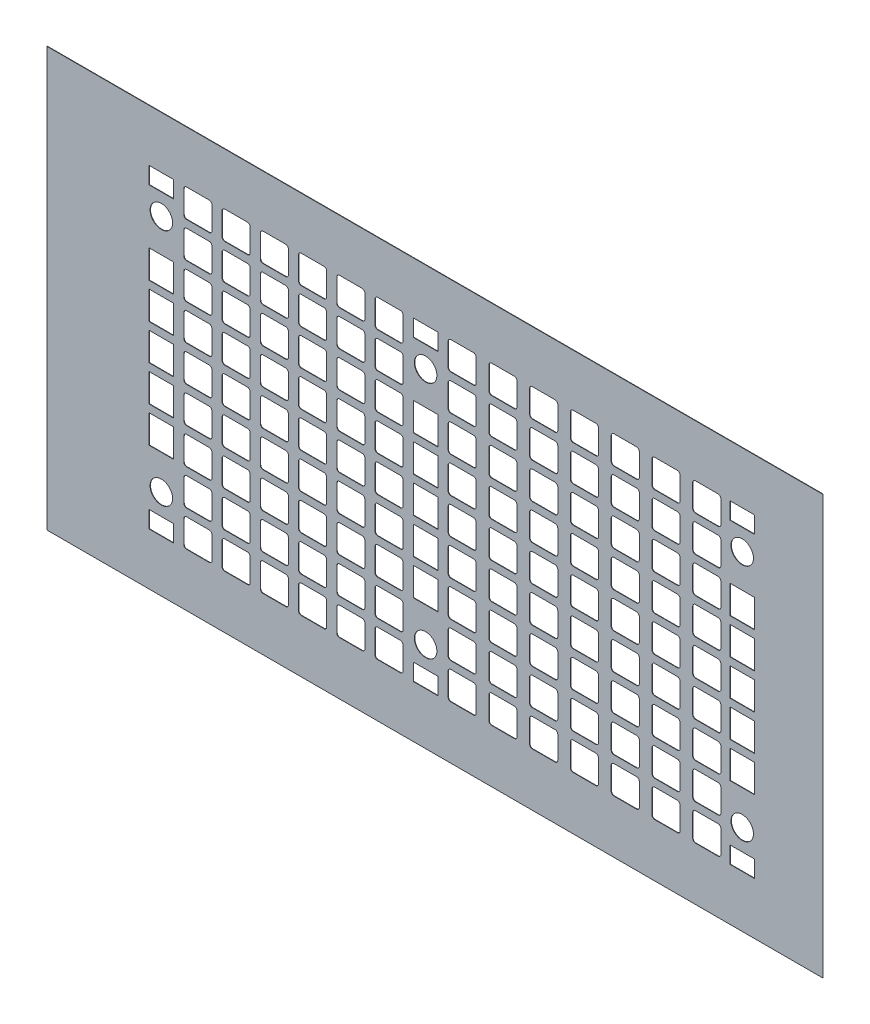
from build123d import *

# Parameters (mm, degrees)
SKETCH_1_W      = 276
SKETCH_1_H      = 149
SKETCH_1_R      = 4
SKETCH_1_W_2    = 8.8
SKETCH_1_H_2    = 10
SKETCH_1_H_3    = 6
EXTRUDE_1_DEPTH = 0.15


with BuildPart() as part:
    # Эскиз1 → Бобышка-Вытянуть1 (new body)
    with BuildSketch(Plane.XY):
        with Locations((110, 59)):
            Rectangle(SKETCH_1_W, SKETCH_1_H)
        with Locations((12.74, 16.55)):
            Circle(SKETCH_1_R, mode=Mode.SUBTRACT)
        with Locations((106.74, 16.55)):
            Circle(SKETCH_1_R, mode=Mode.SUBTRACT)
        with Locations((219.34, 16.55)):
            Circle(SKETCH_1_R, mode=Mode.SUBTRACT)
        with Locations((12.74, 101.45)):
            Circle(SKETCH_1_R, mode=Mode.SUBTRACT)
        with Locations((106.74, 101.45)):
            Circle(SKETCH_1_R, mode=Mode.SUBTRACT)
        with Locations((219.34, 101.45)):
            Circle(SKETCH_1_R, mode=Mode.SUBTRACT)
        with BuildLine():
            Line((34.34, 114), (34.34, 106))
            ThreePointArc((34.34, 106), (34.632893219, 105.292893219), (35.34, 105))
            Line((35.34, 105), (43.34, 105))
            ThreePointArc((43.34, 105), (44.047106781, 105.292893219), (44.34, 106))
            Line((44.34, 106), (44.34, 114))
            ThreePointArc((44.34, 114), (44.047106781, 114.707106781), (43.34, 115))
            Line((43.34, 115), (35.34, 115))
            ThreePointArc((35.34, 115), (34.632893219, 114.707106781), (34.34, 114))
        make_face(mode=Mode.SUBTRACT)
        with BuildLine():
            Line((21.74, 115), (29.74, 115))
            ThreePointArc((29.74, 115), (30.447106781, 114.707106781), (30.74, 114))
            Line((30.74, 114), (30.74, 106))
            ThreePointArc((30.74, 106), (30.447106781, 105.292893219), (29.74, 105))
            Line((29.74, 105), (21.74, 105))
            ThreePointArc((21.74, 105), (21.032893219, 105.292893219), (20.74, 106))
            Line((20.74, 106), (20.74, 114))
            ThreePointArc((20.74, 114), (21.032893219, 114.707106781), (21.74, 115))
        make_face(mode=Mode.SUBTRACT)
        with BuildLine():
            Line((47.94, 114), (47.94, 106))
            ThreePointArc((47.94, 106), (48.232893219, 105.292893219), (48.94, 105))
            Line((48.94, 105), (56.94, 105))
            ThreePointArc((56.94, 105), (57.647106781, 105.292893219), (57.94, 106))
            Line((57.94, 106), (57.94, 114))
            ThreePointArc((57.94, 114), (57.647106781, 114.707106781), (56.94, 115))
            Line((56.94, 115), (48.94, 115))
            ThreePointArc((48.94, 115), (48.232893219, 114.707106781), (47.94, 114))
        make_face(mode=Mode.SUBTRACT)
        with BuildLine():
            Line((61.54, 114), (61.54, 106))
            ThreePointArc((61.54, 106), (61.832893219, 105.292893219), (62.54, 105))
            Line((62.54, 105), (70.54, 105))
            ThreePointArc((70.54, 105), (71.247106781, 105.292893219), (71.54, 106))
            Line((71.54, 106), (71.54, 114))
            ThreePointArc((71.54, 114), (71.247106781, 114.707106781), (70.54, 115))
            Line((70.54, 115), (62.54, 115))
            ThreePointArc((62.54, 115), (61.832893219, 114.707106781), (61.54, 114))
        make_face(mode=Mode.SUBTRACT)
        with BuildLine():
            Line((75.14, 114), (75.14, 106))
            ThreePointArc((75.14, 106), (75.432893219, 105.292893219), (76.14, 105))
            Line((76.14, 105), (84.14, 105))
            ThreePointArc((84.14, 105), (84.847106781, 105.292893219), (85.14, 106))
            Line((85.14, 106), (85.14, 114))
            ThreePointArc((85.14, 114), (84.847106781, 114.707106781), (84.14, 115))
            Line((84.14, 115), (76.14, 115))
            ThreePointArc((76.14, 115), (75.432893219, 114.707106781), (75.14, 114))
        make_face(mode=Mode.SUBTRACT)
        with BuildLine():
            Line((88.74, 114), (88.74, 106))
            ThreePointArc((88.74, 106), (89.032893219, 105.292893219), (89.74, 105))
            Line((89.74, 105), (97.74, 105))
            ThreePointArc((97.74, 105), (98.447106781, 105.292893219), (98.74, 106))
            Line((98.74, 106), (98.74, 114))
            ThreePointArc((98.74, 114), (98.447106781, 114.707106781), (97.74, 115))
            Line((97.74, 115), (89.74, 115))
            ThreePointArc((89.74, 115), (89.032893219, 114.707106781), (88.74, 114))
        make_face(mode=Mode.SUBTRACT)
        with BuildLine():
            Line((34.34, 101.3), (34.34, 93.3))
            ThreePointArc((34.34, 93.3), (34.632893219, 92.592893219), (35.34, 92.3))
            Line((35.34, 92.3), (43.34, 92.3))
            ThreePointArc((43.34, 92.3), (44.047106781, 92.592893219), (44.34, 93.3))
            Line((44.34, 93.3), (44.34, 101.3))
            ThreePointArc((44.34, 101.3), (44.047106781, 102.007106781), (43.34, 102.3))
            Line((43.34, 102.3), (35.34, 102.3))
            ThreePointArc((35.34, 102.3), (34.632893219, 102.007106781), (34.34, 101.3))
        make_face(mode=Mode.SUBTRACT)
        with BuildLine():
            Line((47.94, 101.3), (47.94, 93.3))
            ThreePointArc((47.94, 93.3), (48.232893219, 92.592893219), (48.94, 92.3))
            Line((48.94, 92.3), (56.94, 92.3))
            ThreePointArc((56.94, 92.3), (57.647106781, 92.592893219), (57.94, 93.3))
            Line((57.94, 93.3), (57.94, 101.3))
            ThreePointArc((57.94, 101.3), (57.647106781, 102.007106781), (56.94, 102.3))
            Line((56.94, 102.3), (48.94, 102.3))
            ThreePointArc((48.94, 102.3), (48.232893219, 102.007106781), (47.94, 101.3))
        make_face(mode=Mode.SUBTRACT)
        with BuildLine():
            Line((61.54, 101.3), (61.54, 93.3))
            ThreePointArc((61.54, 93.3), (61.832893219, 92.592893219), (62.54, 92.3))
            Line((62.54, 92.3), (70.54, 92.3))
            ThreePointArc((70.54, 92.3), (71.247106781, 92.592893219), (71.54, 93.3))
            Line((71.54, 93.3), (71.54, 101.3))
            ThreePointArc((71.54, 101.3), (71.247106781, 102.007106781), (70.54, 102.3))
            Line((70.54, 102.3), (62.54, 102.3))
            ThreePointArc((62.54, 102.3), (61.832893219, 102.007106781), (61.54, 101.3))
        make_face(mode=Mode.SUBTRACT)
        with BuildLine():
            Line((75.14, 101.3), (75.14, 93.3))
            ThreePointArc((75.14, 93.3), (75.432893219, 92.592893219), (76.14, 92.3))
            Line((76.14, 92.3), (84.14, 92.3))
            ThreePointArc((84.14, 92.3), (84.847106781, 92.592893219), (85.14, 93.3))
            Line((85.14, 93.3), (85.14, 101.3))
            ThreePointArc((85.14, 101.3), (84.847106781, 102.007106781), (84.14, 102.3))
            Line((84.14, 102.3), (76.14, 102.3))
            ThreePointArc((76.14, 102.3), (75.432893219, 102.007106781), (75.14, 101.3))
        make_face(mode=Mode.SUBTRACT)
        with BuildLine():
            Line((88.74, 101.3), (88.74, 93.3))
            ThreePointArc((88.74, 93.3), (89.032893219, 92.592893219), (89.74, 92.3))
            Line((89.74, 92.3), (97.74, 92.3))
            ThreePointArc((97.74, 92.3), (98.447106781, 92.592893219), (98.74, 93.3))
            Line((98.74, 93.3), (98.74, 101.3))
            ThreePointArc((98.74, 101.3), (98.447106781, 102.007106781), (97.74, 102.3))
            Line((97.74, 102.3), (89.74, 102.3))
            ThreePointArc((89.74, 102.3), (89.032893219, 102.007106781), (88.74, 101.3))
        make_face(mode=Mode.SUBTRACT)
        with BuildLine():
            Line((34.34, 88.6), (34.34, 80.6))
            ThreePointArc((34.34, 80.6), (34.632893219, 79.892893219), (35.34, 79.6))
            Line((35.34, 79.6), (43.34, 79.6))
            ThreePointArc((43.34, 79.6), (44.047106781, 79.892893219), (44.34, 80.6))
            Line((44.34, 80.6), (44.34, 88.6))
            ThreePointArc((44.34, 88.6), (44.047106781, 89.307106781), (43.34, 89.6))
            Line((43.34, 89.6), (35.34, 89.6))
            ThreePointArc((35.34, 89.6), (34.632893219, 89.307106781), (34.34, 88.6))
        make_face(mode=Mode.SUBTRACT)
        with BuildLine():
            Line((47.94, 88.6), (47.94, 80.6))
            ThreePointArc((47.94, 80.6), (48.232893219, 79.892893219), (48.94, 79.6))
            Line((48.94, 79.6), (56.94, 79.6))
            ThreePointArc((56.94, 79.6), (57.647106781, 79.892893219), (57.94, 80.6))
            Line((57.94, 80.6), (57.94, 88.6))
            ThreePointArc((57.94, 88.6), (57.647106781, 89.307106781), (56.94, 89.6))
            Line((56.94, 89.6), (48.94, 89.6))
            ThreePointArc((48.94, 89.6), (48.232893219, 89.307106781), (47.94, 88.6))
        make_face(mode=Mode.SUBTRACT)
        with BuildLine():
            Line((61.54, 88.6), (61.54, 80.6))
            ThreePointArc((61.54, 80.6), (61.832893219, 79.892893219), (62.54, 79.6))
            Line((62.54, 79.6), (70.54, 79.6))
            ThreePointArc((70.54, 79.6), (71.247106781, 79.892893219), (71.54, 80.6))
            Line((71.54, 80.6), (71.54, 88.6))
            ThreePointArc((71.54, 88.6), (71.247106781, 89.307106781), (70.54, 89.6))
            Line((70.54, 89.6), (62.54, 89.6))
            ThreePointArc((62.54, 89.6), (61.832893219, 89.307106781), (61.54, 88.6))
        make_face(mode=Mode.SUBTRACT)
        with BuildLine():
            Line((75.14, 88.6), (75.14, 80.6))
            ThreePointArc((75.14, 80.6), (75.432893219, 79.892893219), (76.14, 79.6))
            Line((76.14, 79.6), (84.14, 79.6))
            ThreePointArc((84.14, 79.6), (84.847106781, 79.892893219), (85.14, 80.6))
            Line((85.14, 80.6), (85.14, 88.6))
            ThreePointArc((85.14, 88.6), (84.847106781, 89.307106781), (84.14, 89.6))
            Line((84.14, 89.6), (76.14, 89.6))
            ThreePointArc((76.14, 89.6), (75.432893219, 89.307106781), (75.14, 88.6))
        make_face(mode=Mode.SUBTRACT)
        with BuildLine():
            Line((88.74, 88.6), (88.74, 80.6))
            ThreePointArc((88.74, 80.6), (89.032893219, 79.892893219), (89.74, 79.6))
            Line((89.74, 79.6), (97.74, 79.6))
            ThreePointArc((97.74, 79.6), (98.447106781, 79.892893219), (98.74, 80.6))
            Line((98.74, 80.6), (98.74, 88.6))
            ThreePointArc((98.74, 88.6), (98.447106781, 89.307106781), (97.74, 89.6))
            Line((97.74, 89.6), (89.74, 89.6))
            ThreePointArc((89.74, 89.6), (89.032893219, 89.307106781), (88.74, 88.6))
        make_face(mode=Mode.SUBTRACT)
        with BuildLine():
            Line((34.34, 75.9), (34.34, 67.9))
            ThreePointArc((34.34, 67.9), (34.632893219, 67.192893219), (35.34, 66.9))
            Line((35.34, 66.9), (43.34, 66.9))
            ThreePointArc((43.34, 66.9), (44.047106781, 67.192893219), (44.34, 67.9))
            Line((44.34, 67.9), (44.34, 75.9))
            ThreePointArc((44.34, 75.9), (44.047106781, 76.607106781), (43.34, 76.9))
            Line((43.34, 76.9), (35.34, 76.9))
            ThreePointArc((35.34, 76.9), (34.632893219, 76.607106781), (34.34, 75.9))
        make_face(mode=Mode.SUBTRACT)
        with BuildLine():
            Line((47.94, 75.9), (47.94, 67.9))
            ThreePointArc((47.94, 67.9), (48.232893219, 67.192893219), (48.94, 66.9))
            Line((48.94, 66.9), (56.94, 66.9))
            ThreePointArc((56.94, 66.9), (57.647106781, 67.192893219), (57.94, 67.9))
            Line((57.94, 67.9), (57.94, 75.9))
            ThreePointArc((57.94, 75.9), (57.647106781, 76.607106781), (56.94, 76.9))
            Line((56.94, 76.9), (48.94, 76.9))
            ThreePointArc((48.94, 76.9), (48.232893219, 76.607106781), (47.94, 75.9))
        make_face(mode=Mode.SUBTRACT)
        with BuildLine():
            Line((61.54, 75.9), (61.54, 67.9))
            ThreePointArc((61.54, 67.9), (61.832893219, 67.192893219), (62.54, 66.9))
            Line((62.54, 66.9), (70.54, 66.9))
            ThreePointArc((70.54, 66.9), (71.247106781, 67.192893219), (71.54, 67.9))
            Line((71.54, 67.9), (71.54, 75.9))
            ThreePointArc((71.54, 75.9), (71.247106781, 76.607106781), (70.54, 76.9))
            Line((70.54, 76.9), (62.54, 76.9))
            ThreePointArc((62.54, 76.9), (61.832893219, 76.607106781), (61.54, 75.9))
        make_face(mode=Mode.SUBTRACT)
        with BuildLine():
            Line((75.14, 75.9), (75.14, 67.9))
            ThreePointArc((75.14, 67.9), (75.432893219, 67.192893219), (76.14, 66.9))
            Line((76.14, 66.9), (84.14, 66.9))
            ThreePointArc((84.14, 66.9), (84.847106781, 67.192893219), (85.14, 67.9))
            Line((85.14, 67.9), (85.14, 75.9))
            ThreePointArc((85.14, 75.9), (84.847106781, 76.607106781), (84.14, 76.9))
            Line((84.14, 76.9), (76.14, 76.9))
            ThreePointArc((76.14, 76.9), (75.432893219, 76.607106781), (75.14, 75.9))
        make_face(mode=Mode.SUBTRACT)
        with BuildLine():
            Line((88.74, 75.9), (88.74, 67.9))
            ThreePointArc((88.74, 67.9), (89.032893219, 67.192893219), (89.74, 66.9))
            Line((89.74, 66.9), (97.74, 66.9))
            ThreePointArc((97.74, 66.9), (98.447106781, 67.192893219), (98.74, 67.9))
            Line((98.74, 67.9), (98.74, 75.9))
            ThreePointArc((98.74, 75.9), (98.447106781, 76.607106781), (97.74, 76.9))
            Line((97.74, 76.9), (89.74, 76.9))
            ThreePointArc((89.74, 76.9), (89.032893219, 76.607106781), (88.74, 75.9))
        make_face(mode=Mode.SUBTRACT)
        with BuildLine():
            Line((34.34, 63.2), (34.34, 55.2))
            ThreePointArc((34.34, 55.2), (34.632893219, 54.492893219), (35.34, 54.2))
            Line((35.34, 54.2), (43.34, 54.2))
            ThreePointArc((43.34, 54.2), (44.047106781, 54.492893219), (44.34, 55.2))
            Line((44.34, 55.2), (44.34, 63.2))
            ThreePointArc((44.34, 63.2), (44.047106781, 63.907106781), (43.34, 64.2))
            Line((43.34, 64.2), (35.34, 64.2))
            ThreePointArc((35.34, 64.2), (34.632893219, 63.907106781), (34.34, 63.2))
        make_face(mode=Mode.SUBTRACT)
        with BuildLine():
            Line((47.94, 63.2), (47.94, 55.2))
            ThreePointArc((47.94, 55.2), (48.232893219, 54.492893219), (48.94, 54.2))
            Line((48.94, 54.2), (56.94, 54.2))
            ThreePointArc((56.94, 54.2), (57.647106781, 54.492893219), (57.94, 55.2))
            Line((57.94, 55.2), (57.94, 63.2))
            ThreePointArc((57.94, 63.2), (57.647106781, 63.907106781), (56.94, 64.2))
            Line((56.94, 64.2), (48.94, 64.2))
            ThreePointArc((48.94, 64.2), (48.232893219, 63.907106781), (47.94, 63.2))
        make_face(mode=Mode.SUBTRACT)
        with BuildLine():
            Line((61.54, 63.2), (61.54, 55.2))
            ThreePointArc((61.54, 55.2), (61.832893219, 54.492893219), (62.54, 54.2))
            Line((62.54, 54.2), (70.54, 54.2))
            ThreePointArc((70.54, 54.2), (71.247106781, 54.492893219), (71.54, 55.2))
            Line((71.54, 55.2), (71.54, 63.2))
            ThreePointArc((71.54, 63.2), (71.247106781, 63.907106781), (70.54, 64.2))
            Line((70.54, 64.2), (62.54, 64.2))
            ThreePointArc((62.54, 64.2), (61.832893219, 63.907106781), (61.54, 63.2))
        make_face(mode=Mode.SUBTRACT)
        with BuildLine():
            Line((75.14, 63.2), (75.14, 55.2))
            ThreePointArc((75.14, 55.2), (75.432893219, 54.492893219), (76.14, 54.2))
            Line((76.14, 54.2), (84.14, 54.2))
            ThreePointArc((84.14, 54.2), (84.847106781, 54.492893219), (85.14, 55.2))
            Line((85.14, 55.2), (85.14, 63.2))
            ThreePointArc((85.14, 63.2), (84.847106781, 63.907106781), (84.14, 64.2))
            Line((84.14, 64.2), (76.14, 64.2))
            ThreePointArc((76.14, 64.2), (75.432893219, 63.907106781), (75.14, 63.2))
        make_face(mode=Mode.SUBTRACT)
        with BuildLine():
            Line((88.74, 63.2), (88.74, 55.2))
            ThreePointArc((88.74, 55.2), (89.032893219, 54.492893219), (89.74, 54.2))
            Line((89.74, 54.2), (97.74, 54.2))
            ThreePointArc((97.74, 54.2), (98.447106781, 54.492893219), (98.74, 55.2))
            Line((98.74, 55.2), (98.74, 63.2))
            ThreePointArc((98.74, 63.2), (98.447106781, 63.907106781), (97.74, 64.2))
            Line((97.74, 64.2), (89.74, 64.2))
            ThreePointArc((89.74, 64.2), (89.032893219, 63.907106781), (88.74, 63.2))
        make_face(mode=Mode.SUBTRACT)
        with BuildLine():
            Line((34.34, 50.5), (34.34, 42.5))
            ThreePointArc((34.34, 42.5), (34.632893219, 41.792893219), (35.34, 41.5))
            Line((35.34, 41.5), (43.34, 41.5))
            ThreePointArc((43.34, 41.5), (44.047106781, 41.792893219), (44.34, 42.5))
            Line((44.34, 42.5), (44.34, 50.5))
            ThreePointArc((44.34, 50.5), (44.047106781, 51.207106781), (43.34, 51.5))
            Line((43.34, 51.5), (35.34, 51.5))
            ThreePointArc((35.34, 51.5), (34.632893219, 51.207106781), (34.34, 50.5))
        make_face(mode=Mode.SUBTRACT)
        with BuildLine():
            Line((47.94, 50.5), (47.94, 42.5))
            ThreePointArc((47.94, 42.5), (48.232893219, 41.792893219), (48.94, 41.5))
            Line((48.94, 41.5), (56.94, 41.5))
            ThreePointArc((56.94, 41.5), (57.647106781, 41.792893219), (57.94, 42.5))
            Line((57.94, 42.5), (57.94, 50.5))
            ThreePointArc((57.94, 50.5), (57.647106781, 51.207106781), (56.94, 51.5))
            Line((56.94, 51.5), (48.94, 51.5))
            ThreePointArc((48.94, 51.5), (48.232893219, 51.207106781), (47.94, 50.5))
        make_face(mode=Mode.SUBTRACT)
        with BuildLine():
            Line((61.54, 50.5), (61.54, 42.5))
            ThreePointArc((61.54, 42.5), (61.832893219, 41.792893219), (62.54, 41.5))
            Line((62.54, 41.5), (70.54, 41.5))
            ThreePointArc((70.54, 41.5), (71.247106781, 41.792893219), (71.54, 42.5))
            Line((71.54, 42.5), (71.54, 50.5))
            ThreePointArc((71.54, 50.5), (71.247106781, 51.207106781), (70.54, 51.5))
            Line((70.54, 51.5), (62.54, 51.5))
            ThreePointArc((62.54, 51.5), (61.832893219, 51.207106781), (61.54, 50.5))
        make_face(mode=Mode.SUBTRACT)
        with BuildLine():
            Line((75.14, 50.5), (75.14, 42.5))
            ThreePointArc((75.14, 42.5), (75.432893219, 41.792893219), (76.14, 41.5))
            Line((76.14, 41.5), (84.14, 41.5))
            ThreePointArc((84.14, 41.5), (84.847106781, 41.792893219), (85.14, 42.5))
            Line((85.14, 42.5), (85.14, 50.5))
            ThreePointArc((85.14, 50.5), (84.847106781, 51.207106781), (84.14, 51.5))
            Line((84.14, 51.5), (76.14, 51.5))
            ThreePointArc((76.14, 51.5), (75.432893219, 51.207106781), (75.14, 50.5))
        make_face(mode=Mode.SUBTRACT)
        with BuildLine():
            Line((88.74, 50.5), (88.74, 42.5))
            ThreePointArc((88.74, 42.5), (89.032893219, 41.792893219), (89.74, 41.5))
            Line((89.74, 41.5), (97.74, 41.5))
            ThreePointArc((97.74, 41.5), (98.447106781, 41.792893219), (98.74, 42.5))
            Line((98.74, 42.5), (98.74, 50.5))
            ThreePointArc((98.74, 50.5), (98.447106781, 51.207106781), (97.74, 51.5))
            Line((97.74, 51.5), (89.74, 51.5))
            ThreePointArc((89.74, 51.5), (89.032893219, 51.207106781), (88.74, 50.5))
        make_face(mode=Mode.SUBTRACT)
        with BuildLine():
            Line((34.34, 37.8), (34.34, 29.8))
            ThreePointArc((34.34, 29.8), (34.632893219, 29.092893219), (35.34, 28.8))
            Line((35.34, 28.8), (43.34, 28.8))
            ThreePointArc((43.34, 28.8), (44.047106781, 29.092893219), (44.34, 29.8))
            Line((44.34, 29.8), (44.34, 37.8))
            ThreePointArc((44.34, 37.8), (44.047106781, 38.507106781), (43.34, 38.8))
            Line((43.34, 38.8), (35.34, 38.8))
            ThreePointArc((35.34, 38.8), (34.632893219, 38.507106781), (34.34, 37.8))
        make_face(mode=Mode.SUBTRACT)
        with BuildLine():
            Line((47.94, 37.8), (47.94, 29.8))
            ThreePointArc((47.94, 29.8), (48.232893219, 29.092893219), (48.94, 28.8))
            Line((48.94, 28.8), (56.94, 28.8))
            ThreePointArc((56.94, 28.8), (57.647106781, 29.092893219), (57.94, 29.8))
            Line((57.94, 29.8), (57.94, 37.8))
            ThreePointArc((57.94, 37.8), (57.647106781, 38.507106781), (56.94, 38.8))
            Line((56.94, 38.8), (48.94, 38.8))
            ThreePointArc((48.94, 38.8), (48.232893219, 38.507106781), (47.94, 37.8))
        make_face(mode=Mode.SUBTRACT)
        with BuildLine():
            Line((61.54, 37.8), (61.54, 29.8))
            ThreePointArc((61.54, 29.8), (61.832893219, 29.092893219), (62.54, 28.8))
            Line((62.54, 28.8), (70.54, 28.8))
            ThreePointArc((70.54, 28.8), (71.247106781, 29.092893219), (71.54, 29.8))
            Line((71.54, 29.8), (71.54, 37.8))
            ThreePointArc((71.54, 37.8), (71.247106781, 38.507106781), (70.54, 38.8))
            Line((70.54, 38.8), (62.54, 38.8))
            ThreePointArc((62.54, 38.8), (61.832893219, 38.507106781), (61.54, 37.8))
        make_face(mode=Mode.SUBTRACT)
        with BuildLine():
            Line((75.14, 37.8), (75.14, 29.8))
            ThreePointArc((75.14, 29.8), (75.432893219, 29.092893219), (76.14, 28.8))
            Line((76.14, 28.8), (84.14, 28.8))
            ThreePointArc((84.14, 28.8), (84.847106781, 29.092893219), (85.14, 29.8))
            Line((85.14, 29.8), (85.14, 37.8))
            ThreePointArc((85.14, 37.8), (84.847106781, 38.507106781), (84.14, 38.8))
            Line((84.14, 38.8), (76.14, 38.8))
            ThreePointArc((76.14, 38.8), (75.432893219, 38.507106781), (75.14, 37.8))
        make_face(mode=Mode.SUBTRACT)
        with BuildLine():
            Line((88.74, 37.8), (88.74, 29.8))
            ThreePointArc((88.74, 29.8), (89.032893219, 29.092893219), (89.74, 28.8))
            Line((89.74, 28.8), (97.74, 28.8))
            ThreePointArc((97.74, 28.8), (98.447106781, 29.092893219), (98.74, 29.8))
            Line((98.74, 29.8), (98.74, 37.8))
            ThreePointArc((98.74, 37.8), (98.447106781, 38.507106781), (97.74, 38.8))
            Line((97.74, 38.8), (89.74, 38.8))
            ThreePointArc((89.74, 38.8), (89.032893219, 38.507106781), (88.74, 37.8))
        make_face(mode=Mode.SUBTRACT)
        with BuildLine():
            Line((34.34, 25.1), (34.34, 17.1))
            ThreePointArc((34.34, 17.1), (34.632893219, 16.392893219), (35.34, 16.1))
            Line((35.34, 16.1), (43.34, 16.1))
            ThreePointArc((43.34, 16.1), (44.047106781, 16.392893219), (44.34, 17.1))
            Line((44.34, 17.1), (44.34, 25.1))
            ThreePointArc((44.34, 25.1), (44.047106781, 25.807106781), (43.34, 26.1))
            Line((43.34, 26.1), (35.34, 26.1))
            ThreePointArc((35.34, 26.1), (34.632893219, 25.807106781), (34.34, 25.1))
        make_face(mode=Mode.SUBTRACT)
        with BuildLine():
            Line((47.94, 25.1), (47.94, 17.1))
            ThreePointArc((47.94, 17.1), (48.232893219, 16.392893219), (48.94, 16.1))
            Line((48.94, 16.1), (56.94, 16.1))
            ThreePointArc((56.94, 16.1), (57.647106781, 16.392893219), (57.94, 17.1))
            Line((57.94, 17.1), (57.94, 25.1))
            ThreePointArc((57.94, 25.1), (57.647106781, 25.807106781), (56.94, 26.1))
            Line((56.94, 26.1), (48.94, 26.1))
            ThreePointArc((48.94, 26.1), (48.232893219, 25.807106781), (47.94, 25.1))
        make_face(mode=Mode.SUBTRACT)
        with BuildLine():
            Line((61.54, 25.1), (61.54, 17.1))
            ThreePointArc((61.54, 17.1), (61.832893219, 16.392893219), (62.54, 16.1))
            Line((62.54, 16.1), (70.54, 16.1))
            ThreePointArc((70.54, 16.1), (71.247106781, 16.392893219), (71.54, 17.1))
            Line((71.54, 17.1), (71.54, 25.1))
            ThreePointArc((71.54, 25.1), (71.247106781, 25.807106781), (70.54, 26.1))
            Line((70.54, 26.1), (62.54, 26.1))
            ThreePointArc((62.54, 26.1), (61.832893219, 25.807106781), (61.54, 25.1))
        make_face(mode=Mode.SUBTRACT)
        with BuildLine():
            Line((75.14, 25.1), (75.14, 17.1))
            ThreePointArc((75.14, 17.1), (75.432893219, 16.392893219), (76.14, 16.1))
            Line((76.14, 16.1), (84.14, 16.1))
            ThreePointArc((84.14, 16.1), (84.847106781, 16.392893219), (85.14, 17.1))
            Line((85.14, 17.1), (85.14, 25.1))
            ThreePointArc((85.14, 25.1), (84.847106781, 25.807106781), (84.14, 26.1))
            Line((84.14, 26.1), (76.14, 26.1))
            ThreePointArc((76.14, 26.1), (75.432893219, 25.807106781), (75.14, 25.1))
        make_face(mode=Mode.SUBTRACT)
        with BuildLine():
            Line((88.74, 25.1), (88.74, 17.1))
            ThreePointArc((88.74, 17.1), (89.032893219, 16.392893219), (89.74, 16.1))
            Line((89.74, 16.1), (97.74, 16.1))
            ThreePointArc((97.74, 16.1), (98.447106781, 16.392893219), (98.74, 17.1))
            Line((98.74, 17.1), (98.74, 25.1))
            ThreePointArc((98.74, 25.1), (98.447106781, 25.807106781), (97.74, 26.1))
            Line((97.74, 26.1), (89.74, 26.1))
            ThreePointArc((89.74, 26.1), (89.032893219, 25.807106781), (88.74, 25.1))
        make_face(mode=Mode.SUBTRACT)
        with BuildLine():
            Line((34.34, 12.4), (34.34, 4.4))
            ThreePointArc((34.34, 4.4), (34.632893219, 3.692893219), (35.34, 3.4))
            Line((35.34, 3.4), (43.34, 3.4))
            ThreePointArc((43.34, 3.4), (44.047106781, 3.692893219), (44.34, 4.4))
            Line((44.34, 4.4), (44.34, 12.4))
            ThreePointArc((44.34, 12.4), (44.047106781, 13.107106781), (43.34, 13.4))
            Line((43.34, 13.4), (35.34, 13.4))
            ThreePointArc((35.34, 13.4), (34.632893219, 13.107106781), (34.34, 12.4))
        make_face(mode=Mode.SUBTRACT)
        with BuildLine():
            Line((47.94, 12.4), (47.94, 4.4))
            ThreePointArc((47.94, 4.4), (48.232893219, 3.692893219), (48.94, 3.4))
            Line((48.94, 3.4), (56.94, 3.4))
            ThreePointArc((56.94, 3.4), (57.647106781, 3.692893219), (57.94, 4.4))
            Line((57.94, 4.4), (57.94, 12.4))
            ThreePointArc((57.94, 12.4), (57.647106781, 13.107106781), (56.94, 13.4))
            Line((56.94, 13.4), (48.94, 13.4))
            ThreePointArc((48.94, 13.4), (48.232893219, 13.107106781), (47.94, 12.4))
        make_face(mode=Mode.SUBTRACT)
        with BuildLine():
            Line((61.54, 12.4), (61.54, 4.4))
            ThreePointArc((61.54, 4.4), (61.832893219, 3.692893219), (62.54, 3.4))
            Line((62.54, 3.4), (70.54, 3.4))
            ThreePointArc((70.54, 3.4), (71.247106781, 3.692893219), (71.54, 4.4))
            Line((71.54, 4.4), (71.54, 12.4))
            ThreePointArc((71.54, 12.4), (71.247106781, 13.107106781), (70.54, 13.4))
            Line((70.54, 13.4), (62.54, 13.4))
            ThreePointArc((62.54, 13.4), (61.832893219, 13.107106781), (61.54, 12.4))
        make_face(mode=Mode.SUBTRACT)
        with BuildLine():
            Line((75.14, 12.4), (75.14, 4.4))
            ThreePointArc((75.14, 4.4), (75.432893219, 3.692893219), (76.14, 3.4))
            Line((76.14, 3.4), (84.14, 3.4))
            ThreePointArc((84.14, 3.4), (84.847106781, 3.692893219), (85.14, 4.4))
            Line((85.14, 4.4), (85.14, 12.4))
            ThreePointArc((85.14, 12.4), (84.847106781, 13.107106781), (84.14, 13.4))
            Line((84.14, 13.4), (76.14, 13.4))
            ThreePointArc((76.14, 13.4), (75.432893219, 13.107106781), (75.14, 12.4))
        make_face(mode=Mode.SUBTRACT)
        with BuildLine():
            Line((88.74, 12.4), (88.74, 4.4))
            ThreePointArc((88.74, 4.4), (89.032893219, 3.692893219), (89.74, 3.4))
            Line((89.74, 3.4), (97.74, 3.4))
            ThreePointArc((97.74, 3.4), (98.447106781, 3.692893219), (98.74, 4.4))
            Line((98.74, 4.4), (98.74, 12.4))
            ThreePointArc((98.74, 12.4), (98.447106781, 13.107106781), (97.74, 13.4))
            Line((97.74, 13.4), (89.74, 13.4))
            ThreePointArc((89.74, 13.4), (89.032893219, 13.107106781), (88.74, 12.4))
        make_face(mode=Mode.SUBTRACT)
        with BuildLine():
            Line((20.74, 101.3), (20.74, 93.3))
            ThreePointArc((20.74, 93.3), (21.032893219, 92.592893219), (21.74, 92.3))
            Line((21.74, 92.3), (29.74, 92.3))
            ThreePointArc((29.74, 92.3), (30.447106781, 92.592893219), (30.74, 93.3))
            Line((30.74, 93.3), (30.74, 101.3))
            ThreePointArc((30.74, 101.3), (30.447106781, 102.007106781), (29.74, 102.3))
            Line((29.74, 102.3), (21.74, 102.3))
            ThreePointArc((21.74, 102.3), (21.032893219, 102.007106781), (20.74, 101.3))
        make_face(mode=Mode.SUBTRACT)
        with BuildLine():
            Line((20.74, 88.6), (20.74, 80.6))
            ThreePointArc((20.74, 80.6), (21.032893219, 79.892893219), (21.74, 79.6))
            Line((21.74, 79.6), (29.74, 79.6))
            ThreePointArc((29.74, 79.6), (30.447106781, 79.892893219), (30.74, 80.6))
            Line((30.74, 80.6), (30.74, 88.6))
            ThreePointArc((30.74, 88.6), (30.447106781, 89.307106781), (29.74, 89.6))
            Line((29.74, 89.6), (21.74, 89.6))
            ThreePointArc((21.74, 89.6), (21.032893219, 89.307106781), (20.74, 88.6))
        make_face(mode=Mode.SUBTRACT)
        with BuildLine():
            Line((20.74, 75.9), (20.74, 67.9))
            ThreePointArc((20.74, 67.9), (21.032893219, 67.192893219), (21.74, 66.9))
            Line((21.74, 66.9), (29.74, 66.9))
            ThreePointArc((29.74, 66.9), (30.447106781, 67.192893219), (30.74, 67.9))
            Line((30.74, 67.9), (30.74, 75.9))
            ThreePointArc((30.74, 75.9), (30.447106781, 76.607106781), (29.74, 76.9))
            Line((29.74, 76.9), (21.74, 76.9))
            ThreePointArc((21.74, 76.9), (21.032893219, 76.607106781), (20.74, 75.9))
        make_face(mode=Mode.SUBTRACT)
        with BuildLine():
            Line((20.74, 63.2), (20.74, 55.2))
            ThreePointArc((20.74, 55.2), (21.032893219, 54.492893219), (21.74, 54.2))
            Line((21.74, 54.2), (29.74, 54.2))
            ThreePointArc((29.74, 54.2), (30.447106781, 54.492893219), (30.74, 55.2))
            Line((30.74, 55.2), (30.74, 63.2))
            ThreePointArc((30.74, 63.2), (30.447106781, 63.907106781), (29.74, 64.2))
            Line((29.74, 64.2), (21.74, 64.2))
            ThreePointArc((21.74, 64.2), (21.032893219, 63.907106781), (20.74, 63.2))
        make_face(mode=Mode.SUBTRACT)
        with BuildLine():
            Line((20.74, 50.5), (20.74, 42.5))
            ThreePointArc((20.74, 42.5), (21.032893219, 41.792893219), (21.74, 41.5))
            Line((21.74, 41.5), (29.74, 41.5))
            ThreePointArc((29.74, 41.5), (30.447106781, 41.792893219), (30.74, 42.5))
            Line((30.74, 42.5), (30.74, 50.5))
            ThreePointArc((30.74, 50.5), (30.447106781, 51.207106781), (29.74, 51.5))
            Line((29.74, 51.5), (21.74, 51.5))
            ThreePointArc((21.74, 51.5), (21.032893219, 51.207106781), (20.74, 50.5))
        make_face(mode=Mode.SUBTRACT)
        with BuildLine():
            Line((20.74, 37.8), (20.74, 29.8))
            ThreePointArc((20.74, 29.8), (21.032893219, 29.092893219), (21.74, 28.8))
            Line((21.74, 28.8), (29.74, 28.8))
            ThreePointArc((29.74, 28.8), (30.447106781, 29.092893219), (30.74, 29.8))
            Line((30.74, 29.8), (30.74, 37.8))
            ThreePointArc((30.74, 37.8), (30.447106781, 38.507106781), (29.74, 38.8))
            Line((29.74, 38.8), (21.74, 38.8))
            ThreePointArc((21.74, 38.8), (21.032893219, 38.507106781), (20.74, 37.8))
        make_face(mode=Mode.SUBTRACT)
        with BuildLine():
            Line((20.74, 25.1), (20.74, 17.1))
            ThreePointArc((20.74, 17.1), (21.032893219, 16.392893219), (21.74, 16.1))
            Line((21.74, 16.1), (29.74, 16.1))
            ThreePointArc((29.74, 16.1), (30.447106781, 16.392893219), (30.74, 17.1))
            Line((30.74, 17.1), (30.74, 25.1))
            ThreePointArc((30.74, 25.1), (30.447106781, 25.807106781), (29.74, 26.1))
            Line((29.74, 26.1), (21.74, 26.1))
            ThreePointArc((21.74, 26.1), (21.032893219, 25.807106781), (20.74, 25.1))
        make_face(mode=Mode.SUBTRACT)
        with BuildLine():
            Line((20.74, 12.4), (20.74, 4.4))
            ThreePointArc((20.74, 4.4), (21.032893219, 3.692893219), (21.74, 3.4))
            Line((21.74, 3.4), (29.74, 3.4))
            ThreePointArc((29.74, 3.4), (30.447106781, 3.692893219), (30.74, 4.4))
            Line((30.74, 4.4), (30.74, 12.4))
            ThreePointArc((30.74, 12.4), (30.447106781, 13.107106781), (29.74, 13.4))
            Line((29.74, 13.4), (21.74, 13.4))
            ThreePointArc((21.74, 13.4), (21.032893219, 13.107106781), (20.74, 12.4))
        make_face(mode=Mode.SUBTRACT)
        with BuildLine():
            Line((123.74, 115), (115.74, 115))
            ThreePointArc((115.74, 115), (115.032893219, 114.707106781), (114.74, 114))
            Line((114.74, 114), (114.74, 106))
            ThreePointArc((114.74, 106), (115.032893219, 105.292893219), (115.74, 105))
            Line((115.74, 105), (123.74, 105))
            ThreePointArc((123.74, 105), (124.447106781, 105.292893219), (124.74, 106))
            Line((124.74, 106), (124.74, 114))
            ThreePointArc((124.74, 114), (124.447106781, 114.707106781), (123.74, 115))
        make_face(mode=Mode.SUBTRACT)
        with BuildLine():
            Line((139.24, 114), (139.24, 106))
            ThreePointArc((139.24, 106), (138.947106781, 105.292893219), (138.24, 105))
            Line((138.24, 105), (130.24, 105))
            ThreePointArc((130.24, 105), (129.532893219, 105.292893219), (129.24, 106))
            Line((129.24, 106), (129.24, 114))
            ThreePointArc((129.24, 114), (129.532893219, 114.707106781), (130.24, 115))
            Line((130.24, 115), (138.24, 115))
            ThreePointArc((138.24, 115), (138.947106781, 114.707106781), (139.24, 114))
        make_face(mode=Mode.SUBTRACT)
        with BuildLine():
            Line((153.74, 114), (153.74, 106))
            ThreePointArc((153.74, 106), (153.447106781, 105.292893219), (152.74, 105))
            Line((152.74, 105), (144.74, 105))
            ThreePointArc((144.74, 105), (144.032893219, 105.292893219), (143.74, 106))
            Line((143.74, 106), (143.74, 114))
            ThreePointArc((143.74, 114), (144.032893219, 114.707106781), (144.74, 115))
            Line((144.74, 115), (152.74, 115))
            ThreePointArc((152.74, 115), (153.447106781, 114.707106781), (153.74, 114))
        make_face(mode=Mode.SUBTRACT)
        with BuildLine():
            Line((168.24, 114), (168.24, 106))
            ThreePointArc((168.24, 106), (167.947106781, 105.292893219), (167.24, 105))
            Line((167.24, 105), (159.24, 105))
            ThreePointArc((159.24, 105), (158.532893219, 105.292893219), (158.24, 106))
            Line((158.24, 106), (158.24, 114))
            ThreePointArc((158.24, 114), (158.532893219, 114.707106781), (159.24, 115))
            Line((159.24, 115), (167.24, 115))
            ThreePointArc((167.24, 115), (167.947106781, 114.707106781), (168.24, 114))
        make_face(mode=Mode.SUBTRACT)
        with BuildLine():
            Line((182.74, 114), (182.74, 106))
            ThreePointArc((182.74, 106), (182.447106781, 105.292893219), (181.74, 105))
            Line((181.74, 105), (173.74, 105))
            ThreePointArc((173.74, 105), (173.032893219, 105.292893219), (172.74, 106))
            Line((172.74, 106), (172.74, 114))
            ThreePointArc((172.74, 114), (173.032893219, 114.707106781), (173.74, 115))
            Line((173.74, 115), (181.74, 115))
            ThreePointArc((181.74, 115), (182.447106781, 114.707106781), (182.74, 114))
        make_face(mode=Mode.SUBTRACT)
        with BuildLine():
            Line((197.24, 114), (197.24, 106))
            ThreePointArc((197.24, 106), (196.947106781, 105.292893219), (196.24, 105))
            Line((196.24, 105), (188.24, 105))
            ThreePointArc((188.24, 105), (187.532893219, 105.292893219), (187.24, 106))
            Line((187.24, 106), (187.24, 114))
            ThreePointArc((187.24, 114), (187.532893219, 114.707106781), (188.24, 115))
            Line((188.24, 115), (196.24, 115))
            ThreePointArc((196.24, 115), (196.947106781, 114.707106781), (197.24, 114))
        make_face(mode=Mode.SUBTRACT)
        with BuildLine():
            Line((211.74, 114), (211.74, 106))
            ThreePointArc((211.74, 106), (211.447106781, 105.292893219), (210.74, 105))
            Line((210.74, 105), (202.74, 105))
            ThreePointArc((202.74, 105), (202.032893219, 105.292893219), (201.74, 106))
            Line((201.74, 106), (201.74, 114))
            ThreePointArc((201.74, 114), (202.032893219, 114.707106781), (202.74, 115))
            Line((202.74, 115), (210.74, 115))
            ThreePointArc((210.74, 115), (211.447106781, 114.707106781), (211.74, 114))
        make_face(mode=Mode.SUBTRACT)
        with BuildLine():
            Line((139.24, 101.3), (139.24, 93.3))
            ThreePointArc((139.24, 93.3), (138.947106781, 92.592893219), (138.24, 92.3))
            Line((138.24, 92.3), (130.24, 92.3))
            ThreePointArc((130.24, 92.3), (129.532893219, 92.592893219), (129.24, 93.3))
            Line((129.24, 93.3), (129.24, 101.3))
            ThreePointArc((129.24, 101.3), (129.532893219, 102.007106781), (130.24, 102.3))
            Line((130.24, 102.3), (138.24, 102.3))
            ThreePointArc((138.24, 102.3), (138.947106781, 102.007106781), (139.24, 101.3))
        make_face(mode=Mode.SUBTRACT)
        with BuildLine():
            Line((153.74, 101.3), (153.74, 93.3))
            ThreePointArc((153.74, 93.3), (153.447106781, 92.592893219), (152.74, 92.3))
            Line((152.74, 92.3), (144.74, 92.3))
            ThreePointArc((144.74, 92.3), (144.032893219, 92.592893219), (143.74, 93.3))
            Line((143.74, 93.3), (143.74, 101.3))
            ThreePointArc((143.74, 101.3), (144.032893219, 102.007106781), (144.74, 102.3))
            Line((144.74, 102.3), (152.74, 102.3))
            ThreePointArc((152.74, 102.3), (153.447106781, 102.007106781), (153.74, 101.3))
        make_face(mode=Mode.SUBTRACT)
        with BuildLine():
            Line((168.24, 101.3), (168.24, 93.3))
            ThreePointArc((168.24, 93.3), (167.947106781, 92.592893219), (167.24, 92.3))
            Line((167.24, 92.3), (159.24, 92.3))
            ThreePointArc((159.24, 92.3), (158.532893219, 92.592893219), (158.24, 93.3))
            Line((158.24, 93.3), (158.24, 101.3))
            ThreePointArc((158.24, 101.3), (158.532893219, 102.007106781), (159.24, 102.3))
            Line((159.24, 102.3), (167.24, 102.3))
            ThreePointArc((167.24, 102.3), (167.947106781, 102.007106781), (168.24, 101.3))
        make_face(mode=Mode.SUBTRACT)
        with BuildLine():
            Line((182.74, 101.3), (182.74, 93.3))
            ThreePointArc((182.74, 93.3), (182.447106781, 92.592893219), (181.74, 92.3))
            Line((181.74, 92.3), (173.74, 92.3))
            ThreePointArc((173.74, 92.3), (173.032893219, 92.592893219), (172.74, 93.3))
            Line((172.74, 93.3), (172.74, 101.3))
            ThreePointArc((172.74, 101.3), (173.032893219, 102.007106781), (173.74, 102.3))
            Line((173.74, 102.3), (181.74, 102.3))
            ThreePointArc((181.74, 102.3), (182.447106781, 102.007106781), (182.74, 101.3))
        make_face(mode=Mode.SUBTRACT)
        with BuildLine():
            Line((197.24, 101.3), (197.24, 93.3))
            ThreePointArc((197.24, 93.3), (196.947106781, 92.592893219), (196.24, 92.3))
            Line((196.24, 92.3), (188.24, 92.3))
            ThreePointArc((188.24, 92.3), (187.532893219, 92.592893219), (187.24, 93.3))
            Line((187.24, 93.3), (187.24, 101.3))
            ThreePointArc((187.24, 101.3), (187.532893219, 102.007106781), (188.24, 102.3))
            Line((188.24, 102.3), (196.24, 102.3))
            ThreePointArc((196.24, 102.3), (196.947106781, 102.007106781), (197.24, 101.3))
        make_face(mode=Mode.SUBTRACT)
        with BuildLine():
            Line((211.74, 101.3), (211.74, 93.3))
            ThreePointArc((211.74, 93.3), (211.447106781, 92.592893219), (210.74, 92.3))
            Line((210.74, 92.3), (202.74, 92.3))
            ThreePointArc((202.74, 92.3), (202.032893219, 92.592893219), (201.74, 93.3))
            Line((201.74, 93.3), (201.74, 101.3))
            ThreePointArc((201.74, 101.3), (202.032893219, 102.007106781), (202.74, 102.3))
            Line((202.74, 102.3), (210.74, 102.3))
            ThreePointArc((210.74, 102.3), (211.447106781, 102.007106781), (211.74, 101.3))
        make_face(mode=Mode.SUBTRACT)
        with BuildLine():
            Line((139.24, 88.6), (139.24, 80.6))
            ThreePointArc((139.24, 80.6), (138.947106781, 79.892893219), (138.24, 79.6))
            Line((138.24, 79.6), (130.24, 79.6))
            ThreePointArc((130.24, 79.6), (129.532893219, 79.892893219), (129.24, 80.6))
            Line((129.24, 80.6), (129.24, 88.6))
            ThreePointArc((129.24, 88.6), (129.532893219, 89.307106781), (130.24, 89.6))
            Line((130.24, 89.6), (138.24, 89.6))
            ThreePointArc((138.24, 89.6), (138.947106781, 89.307106781), (139.24, 88.6))
        make_face(mode=Mode.SUBTRACT)
        with BuildLine():
            Line((153.74, 88.6), (153.74, 80.6))
            ThreePointArc((153.74, 80.6), (153.447106781, 79.892893219), (152.74, 79.6))
            Line((152.74, 79.6), (144.74, 79.6))
            ThreePointArc((144.74, 79.6), (144.032893219, 79.892893219), (143.74, 80.6))
            Line((143.74, 80.6), (143.74, 88.6))
            ThreePointArc((143.74, 88.6), (144.032893219, 89.307106781), (144.74, 89.6))
            Line((144.74, 89.6), (152.74, 89.6))
            ThreePointArc((152.74, 89.6), (153.447106781, 89.307106781), (153.74, 88.6))
        make_face(mode=Mode.SUBTRACT)
        with BuildLine():
            Line((168.24, 88.6), (168.24, 80.6))
            ThreePointArc((168.24, 80.6), (167.947106781, 79.892893219), (167.24, 79.6))
            Line((167.24, 79.6), (159.24, 79.6))
            ThreePointArc((159.24, 79.6), (158.532893219, 79.892893219), (158.24, 80.6))
            Line((158.24, 80.6), (158.24, 88.6))
            ThreePointArc((158.24, 88.6), (158.532893219, 89.307106781), (159.24, 89.6))
            Line((159.24, 89.6), (167.24, 89.6))
            ThreePointArc((167.24, 89.6), (167.947106781, 89.307106781), (168.24, 88.6))
        make_face(mode=Mode.SUBTRACT)
        with BuildLine():
            Line((182.74, 88.6), (182.74, 80.6))
            ThreePointArc((182.74, 80.6), (182.447106781, 79.892893219), (181.74, 79.6))
            Line((181.74, 79.6), (173.74, 79.6))
            ThreePointArc((173.74, 79.6), (173.032893219, 79.892893219), (172.74, 80.6))
            Line((172.74, 80.6), (172.74, 88.6))
            ThreePointArc((172.74, 88.6), (173.032893219, 89.307106781), (173.74, 89.6))
            Line((173.74, 89.6), (181.74, 89.6))
            ThreePointArc((181.74, 89.6), (182.447106781, 89.307106781), (182.74, 88.6))
        make_face(mode=Mode.SUBTRACT)
        with BuildLine():
            Line((197.24, 88.6), (197.24, 80.6))
            ThreePointArc((197.24, 80.6), (196.947106781, 79.892893219), (196.24, 79.6))
            Line((196.24, 79.6), (188.24, 79.6))
            ThreePointArc((188.24, 79.6), (187.532893219, 79.892893219), (187.24, 80.6))
            Line((187.24, 80.6), (187.24, 88.6))
            ThreePointArc((187.24, 88.6), (187.532893219, 89.307106781), (188.24, 89.6))
            Line((188.24, 89.6), (196.24, 89.6))
            ThreePointArc((196.24, 89.6), (196.947106781, 89.307106781), (197.24, 88.6))
        make_face(mode=Mode.SUBTRACT)
        with BuildLine():
            Line((211.74, 88.6), (211.74, 80.6))
            ThreePointArc((211.74, 80.6), (211.447106781, 79.892893219), (210.74, 79.6))
            Line((210.74, 79.6), (202.74, 79.6))
            ThreePointArc((202.74, 79.6), (202.032893219, 79.892893219), (201.74, 80.6))
            Line((201.74, 80.6), (201.74, 88.6))
            ThreePointArc((201.74, 88.6), (202.032893219, 89.307106781), (202.74, 89.6))
            Line((202.74, 89.6), (210.74, 89.6))
            ThreePointArc((210.74, 89.6), (211.447106781, 89.307106781), (211.74, 88.6))
        make_face(mode=Mode.SUBTRACT)
        with BuildLine():
            Line((139.24, 75.9), (139.24, 67.9))
            ThreePointArc((139.24, 67.9), (138.947106781, 67.192893219), (138.24, 66.9))
            Line((138.24, 66.9), (130.24, 66.9))
            ThreePointArc((130.24, 66.9), (129.532893219, 67.192893219), (129.24, 67.9))
            Line((129.24, 67.9), (129.24, 75.9))
            ThreePointArc((129.24, 75.9), (129.532893219, 76.607106781), (130.24, 76.9))
            Line((130.24, 76.9), (138.24, 76.9))
            ThreePointArc((138.24, 76.9), (138.947106781, 76.607106781), (139.24, 75.9))
        make_face(mode=Mode.SUBTRACT)
        with BuildLine():
            Line((153.74, 75.9), (153.74, 67.9))
            ThreePointArc((153.74, 67.9), (153.447106781, 67.192893219), (152.74, 66.9))
            Line((152.74, 66.9), (144.74, 66.9))
            ThreePointArc((144.74, 66.9), (144.032893219, 67.192893219), (143.74, 67.9))
            Line((143.74, 67.9), (143.74, 75.9))
            ThreePointArc((143.74, 75.9), (144.032893219, 76.607106781), (144.74, 76.9))
            Line((144.74, 76.9), (152.74, 76.9))
            ThreePointArc((152.74, 76.9), (153.447106781, 76.607106781), (153.74, 75.9))
        make_face(mode=Mode.SUBTRACT)
        with BuildLine():
            Line((168.24, 75.9), (168.24, 67.9))
            ThreePointArc((168.24, 67.9), (167.947106781, 67.192893219), (167.24, 66.9))
            Line((167.24, 66.9), (159.24, 66.9))
            ThreePointArc((159.24, 66.9), (158.532893219, 67.192893219), (158.24, 67.9))
            Line((158.24, 67.9), (158.24, 75.9))
            ThreePointArc((158.24, 75.9), (158.532893219, 76.607106781), (159.24, 76.9))
            Line((159.24, 76.9), (167.24, 76.9))
            ThreePointArc((167.24, 76.9), (167.947106781, 76.607106781), (168.24, 75.9))
        make_face(mode=Mode.SUBTRACT)
        with BuildLine():
            Line((182.74, 75.9), (182.74, 67.9))
            ThreePointArc((182.74, 67.9), (182.447106781, 67.192893219), (181.74, 66.9))
            Line((181.74, 66.9), (173.74, 66.9))
            ThreePointArc((173.74, 66.9), (173.032893219, 67.192893219), (172.74, 67.9))
            Line((172.74, 67.9), (172.74, 75.9))
            ThreePointArc((172.74, 75.9), (173.032893219, 76.607106781), (173.74, 76.9))
            Line((173.74, 76.9), (181.74, 76.9))
            ThreePointArc((181.74, 76.9), (182.447106781, 76.607106781), (182.74, 75.9))
        make_face(mode=Mode.SUBTRACT)
        with BuildLine():
            Line((197.24, 75.9), (197.24, 67.9))
            ThreePointArc((197.24, 67.9), (196.947106781, 67.192893219), (196.24, 66.9))
            Line((196.24, 66.9), (188.24, 66.9))
            ThreePointArc((188.24, 66.9), (187.532893219, 67.192893219), (187.24, 67.9))
            Line((187.24, 67.9), (187.24, 75.9))
            ThreePointArc((187.24, 75.9), (187.532893219, 76.607106781), (188.24, 76.9))
            Line((188.24, 76.9), (196.24, 76.9))
            ThreePointArc((196.24, 76.9), (196.947106781, 76.607106781), (197.24, 75.9))
        make_face(mode=Mode.SUBTRACT)
        with BuildLine():
            Line((211.74, 75.9), (211.74, 67.9))
            ThreePointArc((211.74, 67.9), (211.447106781, 67.192893219), (210.74, 66.9))
            Line((210.74, 66.9), (202.74, 66.9))
            ThreePointArc((202.74, 66.9), (202.032893219, 67.192893219), (201.74, 67.9))
            Line((201.74, 67.9), (201.74, 75.9))
            ThreePointArc((201.74, 75.9), (202.032893219, 76.607106781), (202.74, 76.9))
            Line((202.74, 76.9), (210.74, 76.9))
            ThreePointArc((210.74, 76.9), (211.447106781, 76.607106781), (211.74, 75.9))
        make_face(mode=Mode.SUBTRACT)
        with BuildLine():
            Line((139.24, 63.2), (139.24, 55.2))
            ThreePointArc((139.24, 55.2), (138.947106781, 54.492893219), (138.24, 54.2))
            Line((138.24, 54.2), (130.24, 54.2))
            ThreePointArc((130.24, 54.2), (129.532893219, 54.492893219), (129.24, 55.2))
            Line((129.24, 55.2), (129.24, 63.2))
            ThreePointArc((129.24, 63.2), (129.532893219, 63.907106781), (130.24, 64.2))
            Line((130.24, 64.2), (138.24, 64.2))
            ThreePointArc((138.24, 64.2), (138.947106781, 63.907106781), (139.24, 63.2))
        make_face(mode=Mode.SUBTRACT)
        with BuildLine():
            Line((153.74, 63.2), (153.74, 55.2))
            ThreePointArc((153.74, 55.2), (153.447106781, 54.492893219), (152.74, 54.2))
            Line((152.74, 54.2), (144.74, 54.2))
            ThreePointArc((144.74, 54.2), (144.032893219, 54.492893219), (143.74, 55.2))
            Line((143.74, 55.2), (143.74, 63.2))
            ThreePointArc((143.74, 63.2), (144.032893219, 63.907106781), (144.74, 64.2))
            Line((144.74, 64.2), (152.74, 64.2))
            ThreePointArc((152.74, 64.2), (153.447106781, 63.907106781), (153.74, 63.2))
        make_face(mode=Mode.SUBTRACT)
        with BuildLine():
            Line((168.24, 63.2), (168.24, 55.2))
            ThreePointArc((168.24, 55.2), (167.947106781, 54.492893219), (167.24, 54.2))
            Line((167.24, 54.2), (159.24, 54.2))
            ThreePointArc((159.24, 54.2), (158.532893219, 54.492893219), (158.24, 55.2))
            Line((158.24, 55.2), (158.24, 63.2))
            ThreePointArc((158.24, 63.2), (158.532893219, 63.907106781), (159.24, 64.2))
            Line((159.24, 64.2), (167.24, 64.2))
            ThreePointArc((167.24, 64.2), (167.947106781, 63.907106781), (168.24, 63.2))
        make_face(mode=Mode.SUBTRACT)
        with BuildLine():
            Line((182.74, 63.2), (182.74, 55.2))
            ThreePointArc((182.74, 55.2), (182.447106781, 54.492893219), (181.74, 54.2))
            Line((181.74, 54.2), (173.74, 54.2))
            ThreePointArc((173.74, 54.2), (173.032893219, 54.492893219), (172.74, 55.2))
            Line((172.74, 55.2), (172.74, 63.2))
            ThreePointArc((172.74, 63.2), (173.032893219, 63.907106781), (173.74, 64.2))
            Line((173.74, 64.2), (181.74, 64.2))
            ThreePointArc((181.74, 64.2), (182.447106781, 63.907106781), (182.74, 63.2))
        make_face(mode=Mode.SUBTRACT)
        with BuildLine():
            Line((197.24, 63.2), (197.24, 55.2))
            ThreePointArc((197.24, 55.2), (196.947106781, 54.492893219), (196.24, 54.2))
            Line((196.24, 54.2), (188.24, 54.2))
            ThreePointArc((188.24, 54.2), (187.532893219, 54.492893219), (187.24, 55.2))
            Line((187.24, 55.2), (187.24, 63.2))
            ThreePointArc((187.24, 63.2), (187.532893219, 63.907106781), (188.24, 64.2))
            Line((188.24, 64.2), (196.24, 64.2))
            ThreePointArc((196.24, 64.2), (196.947106781, 63.907106781), (197.24, 63.2))
        make_face(mode=Mode.SUBTRACT)
        with BuildLine():
            Line((211.74, 63.2), (211.74, 55.2))
            ThreePointArc((211.74, 55.2), (211.447106781, 54.492893219), (210.74, 54.2))
            Line((210.74, 54.2), (202.74, 54.2))
            ThreePointArc((202.74, 54.2), (202.032893219, 54.492893219), (201.74, 55.2))
            Line((201.74, 55.2), (201.74, 63.2))
            ThreePointArc((201.74, 63.2), (202.032893219, 63.907106781), (202.74, 64.2))
            Line((202.74, 64.2), (210.74, 64.2))
            ThreePointArc((210.74, 64.2), (211.447106781, 63.907106781), (211.74, 63.2))
        make_face(mode=Mode.SUBTRACT)
        with BuildLine():
            Line((139.24, 50.5), (139.24, 42.5))
            ThreePointArc((139.24, 42.5), (138.947106781, 41.792893219), (138.24, 41.5))
            Line((138.24, 41.5), (130.24, 41.5))
            ThreePointArc((130.24, 41.5), (129.532893219, 41.792893219), (129.24, 42.5))
            Line((129.24, 42.5), (129.24, 50.5))
            ThreePointArc((129.24, 50.5), (129.532893219, 51.207106781), (130.24, 51.5))
            Line((130.24, 51.5), (138.24, 51.5))
            ThreePointArc((138.24, 51.5), (138.947106781, 51.207106781), (139.24, 50.5))
        make_face(mode=Mode.SUBTRACT)
        with BuildLine():
            Line((153.74, 50.5), (153.74, 42.5))
            ThreePointArc((153.74, 42.5), (153.447106781, 41.792893219), (152.74, 41.5))
            Line((152.74, 41.5), (144.74, 41.5))
            ThreePointArc((144.74, 41.5), (144.032893219, 41.792893219), (143.74, 42.5))
            Line((143.74, 42.5), (143.74, 50.5))
            ThreePointArc((143.74, 50.5), (144.032893219, 51.207106781), (144.74, 51.5))
            Line((144.74, 51.5), (152.74, 51.5))
            ThreePointArc((152.74, 51.5), (153.447106781, 51.207106781), (153.74, 50.5))
        make_face(mode=Mode.SUBTRACT)
        with BuildLine():
            Line((168.24, 50.5), (168.24, 42.5))
            ThreePointArc((168.24, 42.5), (167.947106781, 41.792893219), (167.24, 41.5))
            Line((167.24, 41.5), (159.24, 41.5))
            ThreePointArc((159.24, 41.5), (158.532893219, 41.792893219), (158.24, 42.5))
            Line((158.24, 42.5), (158.24, 50.5))
            ThreePointArc((158.24, 50.5), (158.532893219, 51.207106781), (159.24, 51.5))
            Line((159.24, 51.5), (167.24, 51.5))
            ThreePointArc((167.24, 51.5), (167.947106781, 51.207106781), (168.24, 50.5))
        make_face(mode=Mode.SUBTRACT)
        with BuildLine():
            Line((182.74, 50.5), (182.74, 42.5))
            ThreePointArc((182.74, 42.5), (182.447106781, 41.792893219), (181.74, 41.5))
            Line((181.74, 41.5), (173.74, 41.5))
            ThreePointArc((173.74, 41.5), (173.032893219, 41.792893219), (172.74, 42.5))
            Line((172.74, 42.5), (172.74, 50.5))
            ThreePointArc((172.74, 50.5), (173.032893219, 51.207106781), (173.74, 51.5))
            Line((173.74, 51.5), (181.74, 51.5))
            ThreePointArc((181.74, 51.5), (182.447106781, 51.207106781), (182.74, 50.5))
        make_face(mode=Mode.SUBTRACT)
        with BuildLine():
            Line((197.24, 50.5), (197.24, 42.5))
            ThreePointArc((197.24, 42.5), (196.947106781, 41.792893219), (196.24, 41.5))
            Line((196.24, 41.5), (188.24, 41.5))
            ThreePointArc((188.24, 41.5), (187.532893219, 41.792893219), (187.24, 42.5))
            Line((187.24, 42.5), (187.24, 50.5))
            ThreePointArc((187.24, 50.5), (187.532893219, 51.207106781), (188.24, 51.5))
            Line((188.24, 51.5), (196.24, 51.5))
            ThreePointArc((196.24, 51.5), (196.947106781, 51.207106781), (197.24, 50.5))
        make_face(mode=Mode.SUBTRACT)
        with BuildLine():
            Line((211.74, 50.5), (211.74, 42.5))
            ThreePointArc((211.74, 42.5), (211.447106781, 41.792893219), (210.74, 41.5))
            Line((210.74, 41.5), (202.74, 41.5))
            ThreePointArc((202.74, 41.5), (202.032893219, 41.792893219), (201.74, 42.5))
            Line((201.74, 42.5), (201.74, 50.5))
            ThreePointArc((201.74, 50.5), (202.032893219, 51.207106781), (202.74, 51.5))
            Line((202.74, 51.5), (210.74, 51.5))
            ThreePointArc((210.74, 51.5), (211.447106781, 51.207106781), (211.74, 50.5))
        make_face(mode=Mode.SUBTRACT)
        with BuildLine():
            Line((139.24, 37.8), (139.24, 29.8))
            ThreePointArc((139.24, 29.8), (138.947106781, 29.092893219), (138.24, 28.8))
            Line((138.24, 28.8), (130.24, 28.8))
            ThreePointArc((130.24, 28.8), (129.532893219, 29.092893219), (129.24, 29.8))
            Line((129.24, 29.8), (129.24, 37.8))
            ThreePointArc((129.24, 37.8), (129.532893219, 38.507106781), (130.24, 38.8))
            Line((130.24, 38.8), (138.24, 38.8))
            ThreePointArc((138.24, 38.8), (138.947106781, 38.507106781), (139.24, 37.8))
        make_face(mode=Mode.SUBTRACT)
        with BuildLine():
            Line((153.74, 37.8), (153.74, 29.8))
            ThreePointArc((153.74, 29.8), (153.447106781, 29.092893219), (152.74, 28.8))
            Line((152.74, 28.8), (144.74, 28.8))
            ThreePointArc((144.74, 28.8), (144.032893219, 29.092893219), (143.74, 29.8))
            Line((143.74, 29.8), (143.74, 37.8))
            ThreePointArc((143.74, 37.8), (144.032893219, 38.507106781), (144.74, 38.8))
            Line((144.74, 38.8), (152.74, 38.8))
            ThreePointArc((152.74, 38.8), (153.447106781, 38.507106781), (153.74, 37.8))
        make_face(mode=Mode.SUBTRACT)
        with BuildLine():
            Line((168.24, 37.8), (168.24, 29.8))
            ThreePointArc((168.24, 29.8), (167.947106781, 29.092893219), (167.24, 28.8))
            Line((167.24, 28.8), (159.24, 28.8))
            ThreePointArc((159.24, 28.8), (158.532893219, 29.092893219), (158.24, 29.8))
            Line((158.24, 29.8), (158.24, 37.8))
            ThreePointArc((158.24, 37.8), (158.532893219, 38.507106781), (159.24, 38.8))
            Line((159.24, 38.8), (167.24, 38.8))
            ThreePointArc((167.24, 38.8), (167.947106781, 38.507106781), (168.24, 37.8))
        make_face(mode=Mode.SUBTRACT)
        with BuildLine():
            Line((182.74, 37.8), (182.74, 29.8))
            ThreePointArc((182.74, 29.8), (182.447106781, 29.092893219), (181.74, 28.8))
            Line((181.74, 28.8), (173.74, 28.8))
            ThreePointArc((173.74, 28.8), (173.032893219, 29.092893219), (172.74, 29.8))
            Line((172.74, 29.8), (172.74, 37.8))
            ThreePointArc((172.74, 37.8), (173.032893219, 38.507106781), (173.74, 38.8))
            Line((173.74, 38.8), (181.74, 38.8))
            ThreePointArc((181.74, 38.8), (182.447106781, 38.507106781), (182.74, 37.8))
        make_face(mode=Mode.SUBTRACT)
        with BuildLine():
            Line((197.24, 37.8), (197.24, 29.8))
            ThreePointArc((197.24, 29.8), (196.947106781, 29.092893219), (196.24, 28.8))
            Line((196.24, 28.8), (188.24, 28.8))
            ThreePointArc((188.24, 28.8), (187.532893219, 29.092893219), (187.24, 29.8))
            Line((187.24, 29.8), (187.24, 37.8))
            ThreePointArc((187.24, 37.8), (187.532893219, 38.507106781), (188.24, 38.8))
            Line((188.24, 38.8), (196.24, 38.8))
            ThreePointArc((196.24, 38.8), (196.947106781, 38.507106781), (197.24, 37.8))
        make_face(mode=Mode.SUBTRACT)
        with BuildLine():
            Line((211.74, 37.8), (211.74, 29.8))
            ThreePointArc((211.74, 29.8), (211.447106781, 29.092893219), (210.74, 28.8))
            Line((210.74, 28.8), (202.74, 28.8))
            ThreePointArc((202.74, 28.8), (202.032893219, 29.092893219), (201.74, 29.8))
            Line((201.74, 29.8), (201.74, 37.8))
            ThreePointArc((201.74, 37.8), (202.032893219, 38.507106781), (202.74, 38.8))
            Line((202.74, 38.8), (210.74, 38.8))
            ThreePointArc((210.74, 38.8), (211.447106781, 38.507106781), (211.74, 37.8))
        make_face(mode=Mode.SUBTRACT)
        with BuildLine():
            Line((139.24, 25.1), (139.24, 17.1))
            ThreePointArc((139.24, 17.1), (138.947106781, 16.392893219), (138.24, 16.1))
            Line((138.24, 16.1), (130.24, 16.1))
            ThreePointArc((130.24, 16.1), (129.532893219, 16.392893219), (129.24, 17.1))
            Line((129.24, 17.1), (129.24, 25.1))
            ThreePointArc((129.24, 25.1), (129.532893219, 25.807106781), (130.24, 26.1))
            Line((130.24, 26.1), (138.24, 26.1))
            ThreePointArc((138.24, 26.1), (138.947106781, 25.807106781), (139.24, 25.1))
        make_face(mode=Mode.SUBTRACT)
        with BuildLine():
            Line((153.74, 25.1), (153.74, 17.1))
            ThreePointArc((153.74, 17.1), (153.447106781, 16.392893219), (152.74, 16.1))
            Line((152.74, 16.1), (144.74, 16.1))
            ThreePointArc((144.74, 16.1), (144.032893219, 16.392893219), (143.74, 17.1))
            Line((143.74, 17.1), (143.74, 25.1))
            ThreePointArc((143.74, 25.1), (144.032893219, 25.807106781), (144.74, 26.1))
            Line((144.74, 26.1), (152.74, 26.1))
            ThreePointArc((152.74, 26.1), (153.447106781, 25.807106781), (153.74, 25.1))
        make_face(mode=Mode.SUBTRACT)
        with BuildLine():
            Line((168.24, 25.1), (168.24, 17.1))
            ThreePointArc((168.24, 17.1), (167.947106781, 16.392893219), (167.24, 16.1))
            Line((167.24, 16.1), (159.24, 16.1))
            ThreePointArc((159.24, 16.1), (158.532893219, 16.392893219), (158.24, 17.1))
            Line((158.24, 17.1), (158.24, 25.1))
            ThreePointArc((158.24, 25.1), (158.532893219, 25.807106781), (159.24, 26.1))
            Line((159.24, 26.1), (167.24, 26.1))
            ThreePointArc((167.24, 26.1), (167.947106781, 25.807106781), (168.24, 25.1))
        make_face(mode=Mode.SUBTRACT)
        with BuildLine():
            Line((182.74, 25.1), (182.74, 17.1))
            ThreePointArc((182.74, 17.1), (182.447106781, 16.392893219), (181.74, 16.1))
            Line((181.74, 16.1), (173.74, 16.1))
            ThreePointArc((173.74, 16.1), (173.032893219, 16.392893219), (172.74, 17.1))
            Line((172.74, 17.1), (172.74, 25.1))
            ThreePointArc((172.74, 25.1), (173.032893219, 25.807106781), (173.74, 26.1))
            Line((173.74, 26.1), (181.74, 26.1))
            ThreePointArc((181.74, 26.1), (182.447106781, 25.807106781), (182.74, 25.1))
        make_face(mode=Mode.SUBTRACT)
        with BuildLine():
            Line((197.24, 25.1), (197.24, 17.1))
            ThreePointArc((197.24, 17.1), (196.947106781, 16.392893219), (196.24, 16.1))
            Line((196.24, 16.1), (188.24, 16.1))
            ThreePointArc((188.24, 16.1), (187.532893219, 16.392893219), (187.24, 17.1))
            Line((187.24, 17.1), (187.24, 25.1))
            ThreePointArc((187.24, 25.1), (187.532893219, 25.807106781), (188.24, 26.1))
            Line((188.24, 26.1), (196.24, 26.1))
            ThreePointArc((196.24, 26.1), (196.947106781, 25.807106781), (197.24, 25.1))
        make_face(mode=Mode.SUBTRACT)
        with BuildLine():
            Line((211.74, 25.1), (211.74, 17.1))
            ThreePointArc((211.74, 17.1), (211.447106781, 16.392893219), (210.74, 16.1))
            Line((210.74, 16.1), (202.74, 16.1))
            ThreePointArc((202.74, 16.1), (202.032893219, 16.392893219), (201.74, 17.1))
            Line((201.74, 17.1), (201.74, 25.1))
            ThreePointArc((201.74, 25.1), (202.032893219, 25.807106781), (202.74, 26.1))
            Line((202.74, 26.1), (210.74, 26.1))
            ThreePointArc((210.74, 26.1), (211.447106781, 25.807106781), (211.74, 25.1))
        make_face(mode=Mode.SUBTRACT)
        with BuildLine():
            Line((139.24, 12.4), (139.24, 4.4))
            ThreePointArc((139.24, 4.4), (138.947106781, 3.692893219), (138.24, 3.4))
            Line((138.24, 3.4), (130.24, 3.4))
            ThreePointArc((130.24, 3.4), (129.532893219, 3.692893219), (129.24, 4.4))
            Line((129.24, 4.4), (129.24, 12.4))
            ThreePointArc((129.24, 12.4), (129.532893219, 13.107106781), (130.24, 13.4))
            Line((130.24, 13.4), (138.24, 13.4))
            ThreePointArc((138.24, 13.4), (138.947106781, 13.107106781), (139.24, 12.4))
        make_face(mode=Mode.SUBTRACT)
        with BuildLine():
            Line((153.74, 12.4), (153.74, 4.4))
            ThreePointArc((153.74, 4.4), (153.447106781, 3.692893219), (152.74, 3.4))
            Line((152.74, 3.4), (144.74, 3.4))
            ThreePointArc((144.74, 3.4), (144.032893219, 3.692893219), (143.74, 4.4))
            Line((143.74, 4.4), (143.74, 12.4))
            ThreePointArc((143.74, 12.4), (144.032893219, 13.107106781), (144.74, 13.4))
            Line((144.74, 13.4), (152.74, 13.4))
            ThreePointArc((152.74, 13.4), (153.447106781, 13.107106781), (153.74, 12.4))
        make_face(mode=Mode.SUBTRACT)
        with BuildLine():
            Line((168.24, 12.4), (168.24, 4.4))
            ThreePointArc((168.24, 4.4), (167.947106781, 3.692893219), (167.24, 3.4))
            Line((167.24, 3.4), (159.24, 3.4))
            ThreePointArc((159.24, 3.4), (158.532893219, 3.692893219), (158.24, 4.4))
            Line((158.24, 4.4), (158.24, 12.4))
            ThreePointArc((158.24, 12.4), (158.532893219, 13.107106781), (159.24, 13.4))
            Line((159.24, 13.4), (167.24, 13.4))
            ThreePointArc((167.24, 13.4), (167.947106781, 13.107106781), (168.24, 12.4))
        make_face(mode=Mode.SUBTRACT)
        with BuildLine():
            Line((182.74, 12.4), (182.74, 4.4))
            ThreePointArc((182.74, 4.4), (182.447106781, 3.692893219), (181.74, 3.4))
            Line((181.74, 3.4), (173.74, 3.4))
            ThreePointArc((173.74, 3.4), (173.032893219, 3.692893219), (172.74, 4.4))
            Line((172.74, 4.4), (172.74, 12.4))
            ThreePointArc((172.74, 12.4), (173.032893219, 13.107106781), (173.74, 13.4))
            Line((173.74, 13.4), (181.74, 13.4))
            ThreePointArc((181.74, 13.4), (182.447106781, 13.107106781), (182.74, 12.4))
        make_face(mode=Mode.SUBTRACT)
        with BuildLine():
            Line((197.24, 12.4), (197.24, 4.4))
            ThreePointArc((197.24, 4.4), (196.947106781, 3.692893219), (196.24, 3.4))
            Line((196.24, 3.4), (188.24, 3.4))
            ThreePointArc((188.24, 3.4), (187.532893219, 3.692893219), (187.24, 4.4))
            Line((187.24, 4.4), (187.24, 12.4))
            ThreePointArc((187.24, 12.4), (187.532893219, 13.107106781), (188.24, 13.4))
            Line((188.24, 13.4), (196.24, 13.4))
            ThreePointArc((196.24, 13.4), (196.947106781, 13.107106781), (197.24, 12.4))
        make_face(mode=Mode.SUBTRACT)
        with BuildLine():
            Line((211.74, 12.4), (211.74, 4.4))
            ThreePointArc((211.74, 4.4), (211.447106781, 3.692893219), (210.74, 3.4))
            Line((210.74, 3.4), (202.74, 3.4))
            ThreePointArc((202.74, 3.4), (202.032893219, 3.692893219), (201.74, 4.4))
            Line((201.74, 4.4), (201.74, 12.4))
            ThreePointArc((201.74, 12.4), (202.032893219, 13.107106781), (202.74, 13.4))
            Line((202.74, 13.4), (210.74, 13.4))
            ThreePointArc((210.74, 13.4), (211.447106781, 13.107106781), (211.74, 12.4))
        make_face(mode=Mode.SUBTRACT)
        with BuildLine():
            Line((124.74, 101.3), (124.74, 93.3))
            ThreePointArc((124.74, 93.3), (124.447106781, 92.592893219), (123.74, 92.3))
            Line((123.74, 92.3), (115.74, 92.3))
            ThreePointArc((115.74, 92.3), (115.032893219, 92.592893219), (114.74, 93.3))
            Line((114.74, 93.3), (114.74, 101.3))
            ThreePointArc((114.74, 101.3), (115.032893219, 102.007106781), (115.74, 102.3))
            Line((115.74, 102.3), (123.74, 102.3))
            ThreePointArc((123.74, 102.3), (124.447106781, 102.007106781), (124.74, 101.3))
        make_face(mode=Mode.SUBTRACT)
        with BuildLine():
            Line((124.74, 88.6), (124.74, 80.6))
            ThreePointArc((124.74, 80.6), (124.447106781, 79.892893219), (123.74, 79.6))
            Line((123.74, 79.6), (115.74, 79.6))
            ThreePointArc((115.74, 79.6), (115.032893219, 79.892893219), (114.74, 80.6))
            Line((114.74, 80.6), (114.74, 88.6))
            ThreePointArc((114.74, 88.6), (115.032893219, 89.307106781), (115.74, 89.6))
            Line((115.74, 89.6), (123.74, 89.6))
            ThreePointArc((123.74, 89.6), (124.447106781, 89.307106781), (124.74, 88.6))
        make_face(mode=Mode.SUBTRACT)
        with BuildLine():
            Line((124.74, 75.9), (124.74, 67.9))
            ThreePointArc((124.74, 67.9), (124.447106781, 67.192893219), (123.74, 66.9))
            Line((123.74, 66.9), (115.74, 66.9))
            ThreePointArc((115.74, 66.9), (115.032893219, 67.192893219), (114.74, 67.9))
            Line((114.74, 67.9), (114.74, 75.9))
            ThreePointArc((114.74, 75.9), (115.032893219, 76.607106781), (115.74, 76.9))
            Line((115.74, 76.9), (123.74, 76.9))
            ThreePointArc((123.74, 76.9), (124.447106781, 76.607106781), (124.74, 75.9))
        make_face(mode=Mode.SUBTRACT)
        with BuildLine():
            Line((124.74, 63.2), (124.74, 55.2))
            ThreePointArc((124.74, 55.2), (124.447106781, 54.492893219), (123.74, 54.2))
            Line((123.74, 54.2), (115.74, 54.2))
            ThreePointArc((115.74, 54.2), (115.032893219, 54.492893219), (114.74, 55.2))
            Line((114.74, 55.2), (114.74, 63.2))
            ThreePointArc((114.74, 63.2), (115.032893219, 63.907106781), (115.74, 64.2))
            Line((115.74, 64.2), (123.74, 64.2))
            ThreePointArc((123.74, 64.2), (124.447106781, 63.907106781), (124.74, 63.2))
        make_face(mode=Mode.SUBTRACT)
        with BuildLine():
            Line((124.74, 50.5), (124.74, 42.5))
            ThreePointArc((124.74, 42.5), (124.447106781, 41.792893219), (123.74, 41.5))
            Line((123.74, 41.5), (115.74, 41.5))
            ThreePointArc((115.74, 41.5), (115.032893219, 41.792893219), (114.74, 42.5))
            Line((114.74, 42.5), (114.74, 50.5))
            ThreePointArc((114.74, 50.5), (115.032893219, 51.207106781), (115.74, 51.5))
            Line((115.74, 51.5), (123.74, 51.5))
            ThreePointArc((123.74, 51.5), (124.447106781, 51.207106781), (124.74, 50.5))
        make_face(mode=Mode.SUBTRACT)
        with BuildLine():
            Line((124.74, 37.8), (124.74, 29.8))
            ThreePointArc((124.74, 29.8), (124.447106781, 29.092893219), (123.74, 28.8))
            Line((123.74, 28.8), (115.74, 28.8))
            ThreePointArc((115.74, 28.8), (115.032893219, 29.092893219), (114.74, 29.8))
            Line((114.74, 29.8), (114.74, 37.8))
            ThreePointArc((114.74, 37.8), (115.032893219, 38.507106781), (115.74, 38.8))
            Line((115.74, 38.8), (123.74, 38.8))
            ThreePointArc((123.74, 38.8), (124.447106781, 38.507106781), (124.74, 37.8))
        make_face(mode=Mode.SUBTRACT)
        with BuildLine():
            Line((124.74, 25.1), (124.74, 17.1))
            ThreePointArc((124.74, 17.1), (124.447106781, 16.392893219), (123.74, 16.1))
            Line((123.74, 16.1), (115.74, 16.1))
            ThreePointArc((115.74, 16.1), (115.032893219, 16.392893219), (114.74, 17.1))
            Line((114.74, 17.1), (114.74, 25.1))
            ThreePointArc((114.74, 25.1), (115.032893219, 25.807106781), (115.74, 26.1))
            Line((115.74, 26.1), (123.74, 26.1))
            ThreePointArc((123.74, 26.1), (124.447106781, 25.807106781), (124.74, 25.1))
        make_face(mode=Mode.SUBTRACT)
        with BuildLine():
            Line((124.74, 12.4), (124.74, 4.4))
            ThreePointArc((124.74, 4.4), (124.447106781, 3.692893219), (123.74, 3.4))
            Line((123.74, 3.4), (115.74, 3.4))
            ThreePointArc((115.74, 3.4), (115.032893219, 3.692893219), (114.74, 4.4))
            Line((114.74, 4.4), (114.74, 12.4))
            ThreePointArc((114.74, 12.4), (115.032893219, 13.107106781), (115.74, 13.4))
            Line((115.74, 13.4), (123.74, 13.4))
            ThreePointArc((123.74, 13.4), (124.447106781, 13.107106781), (124.74, 12.4))
        make_face(mode=Mode.SUBTRACT)
        with Locations((106.74, 71.9)):
            Rectangle(SKETCH_1_W_2, SKETCH_1_H_2, mode=Mode.SUBTRACT)
        with Locations((106.74, 84.6)):
            Rectangle(SKETCH_1_W_2, SKETCH_1_H_2, mode=Mode.SUBTRACT)
        with Locations((106.74, 59.2)):
            Rectangle(SKETCH_1_W_2, SKETCH_1_H_2, mode=Mode.SUBTRACT)
        with Locations((106.74, 46.5)):
            Rectangle(SKETCH_1_W_2, SKETCH_1_H_2, mode=Mode.SUBTRACT)
        with Locations((106.74, 33.8)):
            Rectangle(SKETCH_1_W_2, SKETCH_1_H_2, mode=Mode.SUBTRACT)
        with Locations((106.74, 6)):
            Rectangle(SKETCH_1_W_2, SKETCH_1_H_3, mode=Mode.SUBTRACT)
        with Locations((106.74, 112)):
            Rectangle(SKETCH_1_W_2, SKETCH_1_H_3, mode=Mode.SUBTRACT)
        with Locations((219.34, 6)):
            Rectangle(SKETCH_1_W_2, SKETCH_1_H_3, mode=Mode.SUBTRACT)
        with Locations((219.34, 33.8)):
            Rectangle(SKETCH_1_W_2, SKETCH_1_H_2, mode=Mode.SUBTRACT)
        with Locations((219.34, 46.5)):
            Rectangle(SKETCH_1_W_2, SKETCH_1_H_2, mode=Mode.SUBTRACT)
        with Locations((219.34, 59.2)):
            Rectangle(SKETCH_1_W_2, SKETCH_1_H_2, mode=Mode.SUBTRACT)
        with Locations((219.34, 71.9)):
            Rectangle(SKETCH_1_W_2, SKETCH_1_H_2, mode=Mode.SUBTRACT)
        with Locations((219.34, 84.6)):
            Rectangle(SKETCH_1_W_2, SKETCH_1_H_2, mode=Mode.SUBTRACT)
        with Locations((219.34, 112)):
            Rectangle(SKETCH_1_W_2, SKETCH_1_H_3, mode=Mode.SUBTRACT)
        with Locations((12.74, 46.5)):
            Rectangle(SKETCH_1_W_2, SKETCH_1_H_2, mode=Mode.SUBTRACT)
        with Locations((12.74, 6)):
            Rectangle(SKETCH_1_W_2, SKETCH_1_H_3, mode=Mode.SUBTRACT)
        with Locations((12.74, 33.8)):
            Rectangle(SKETCH_1_W_2, SKETCH_1_H_2, mode=Mode.SUBTRACT)
        with Locations((12.74, 59.2)):
            Rectangle(SKETCH_1_W_2, SKETCH_1_H_2, mode=Mode.SUBTRACT)
        with Locations((12.74, 71.9)):
            Rectangle(SKETCH_1_W_2, SKETCH_1_H_2, mode=Mode.SUBTRACT)
        with Locations((12.74, 84.6)):
            Rectangle(SKETCH_1_W_2, SKETCH_1_H_2, mode=Mode.SUBTRACT)
        with Locations((12.74, 112)):
            Rectangle(SKETCH_1_W_2, SKETCH_1_H_3, mode=Mode.SUBTRACT)
    extrude(amount=EXTRUDE_1_DEPTH)


solid = part.part
